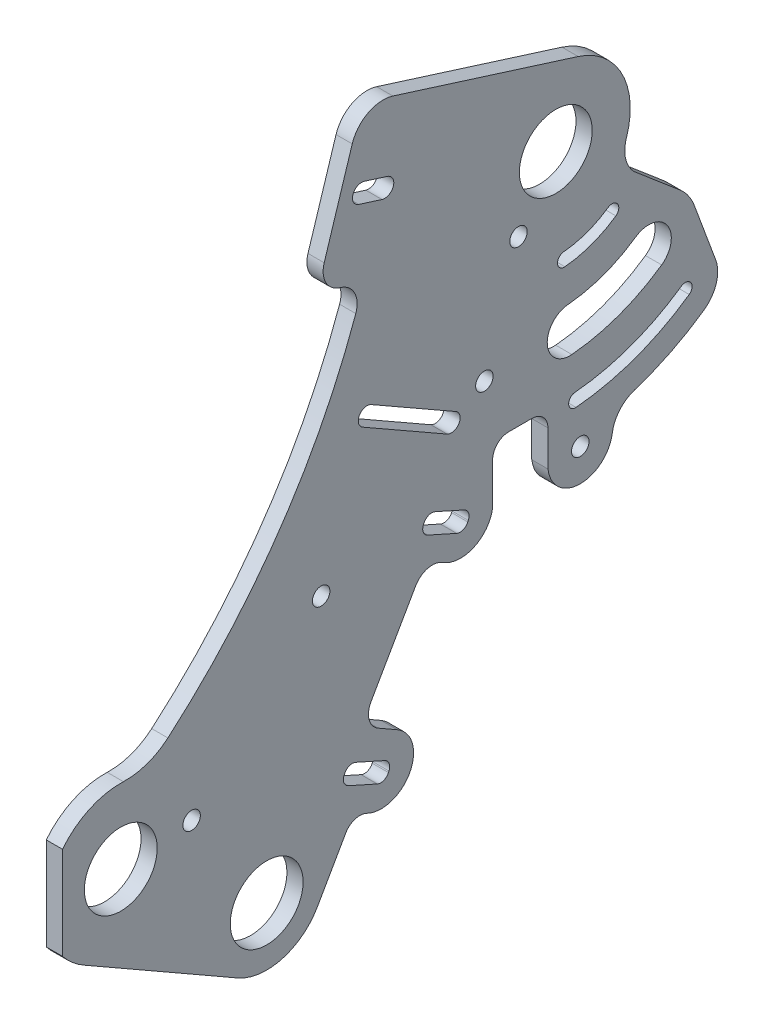
from build123d import *

# Parameters (mm, degrees)
BOSS_EXTRUDE1_DEPTH      = 3.175
BOSS_EXTRUDE1_DEPTH_BACK = 3.175
CUT_EXTRUDE1_DEPTH       = 307.149657193
CUT_EXTRUDE1_DEPTH_BACK  = 307.149657193
SKETCH1_R                = 14.2875
SKETCH1_R_2              = 3.429


with BuildPart() as part:
    # Sketch2 → Boss-Extrude1 (new, two sides: drawn at the far end of the back side and taken through both)
    with BuildSketch(Plane(origin=(0, 0, 0), x_dir=(0, 0, -1), z_dir=(1, 0, 0)).offset(-BOSS_EXTRUDE1_DEPTH_BACK)):
        with BuildLine():
            Line((-71.727341246, 14.712855526), (-11.355316398, -19.840271911))
            ThreePointArc((-11.355316398, -19.840271911), (6.010109789, -22.055796978), (19.850909717, -11.336709549))
            Line((19.850909717, -11.336709549), (31.011761812, 8.206268627))
            ThreePointArc((31.011761812, 8.206268627), (34.662129764, 11.127507824), (39.322849283, 10.758024134))
            ThreePointArc((39.322849283, 10.758024134), (56.134461156, 16.205485457), (51.225250159, 33.182080404))
            Line((51.225250159, 33.182080404), (43.740701856, 37.465762324))
            ThreePointArc((43.740701856, 37.465762324), (40.172936643, 42.0792631), (40.912383352, 47.86429176))
            Line((40.912383352, 47.86429176), (58.4047538, 78.427366702))
            ThreePointArc((58.4047538, 78.427366702), (63.214959672, 82.045828247), (69.150347517, 81.044571224))
            ThreePointArc((69.150347517, 81.044571224), (81.258269009, 80.137892516), (88.594067794, 89.813112686))
            Line((88.594067794, 89.813112686), (88.594067794, 92.199724514))
            Line((88.594067794, 92.199724514), (88.594067794, 106.169724514))
            ThreePointArc((88.594067794, 106.169724514), (90.453939734, 110.659852575), (94.944067794, 112.519724514))
            Line((94.944067794, 112.519724514), (103.937974786, 112.519724514))
            ThreePointArc((103.937974786, 112.519724514), (108.428102847, 110.659852575), (110.287974786, 106.169724514))
            Line((110.287974786, 106.169724514), (110.287974786, 92.199724514))
            Line((110.287974786, 92.199724514), (110.332946369, 92.199724514))
            ThreePointArc((110.332946369, 92.199724514), (122.733798507, 80.828311157), (135.537778495, 91.743817189))
            ThreePointArc((135.537778495, 91.743817189), (138.406050553, 98.151824286), (144.240443192, 102.05687257))
            ThreePointArc((144.240443192, 102.05687257), (158.356459409, 107.777887749), (171.454830285, 115.551214511))
            ThreePointArc((171.454830285, 115.551214511), (176.293542275, 122.170313769), (176.079337299, 130.366637638))
            Line((176.079337299, 130.366637638), (167.652590835, 153.111230605))
            ThreePointArc((167.652590835, 153.111230605), (165.394045644, 157.419573471), (162.117995595, 161.015451766))
            Line((162.117995595, 161.015451766), (144.011829817, 176.386571529))
            ThreePointArc((144.011829817, 176.386571529), (140.738510253, 182.410880382), (141.073716499, 189.25884029))
            ThreePointArc((141.073716499, 189.25884029), (139.389035794, 211.778713703), (122.150711895, 226.367169303))
            Line((122.150711895, 226.367169303), (49.477480248, 249.280951225))
            ThreePointArc((49.477480248, 249.280951225), (39.794309207, 248.433783532), (33.54631132, 240.987709604))
            Line((33.54631132, 240.987709604), (22.547695998, 206.104558413))
            ThreePointArc((22.547695998, 206.104558413), (23.157656737, 199.132675263), (28.518829965, 194.634116785))
            Line((28.518829965, 194.634116785), (29.082706129, 194.456327313))
            ThreePointArc((29.082706129, 194.456327313), (34.521299637, 189.805593755), (34.945098816, 182.662204067))
            ThreePointArc((34.945098816, 182.662204067), (5.090213079, 124.221234623), (-38.738117997, 75.377212399))
            ThreePointArc((-38.738117997, 75.377212399), (-46.886526626, 70.672129884), (-56.188647306, 69.256179485))
            ThreePointArc((-56.188647306, 69.256179485), (-69.442421386, 66.593204099), (-80.077770294, 58.247946829))
            Line((-80.077770294, 58.247946829), (-80.077770294, 21.880681329))
            ThreePointArc((-80.077770294, 21.880681329), (-76.243164901, 17.899962972), (-71.727341246, 14.712855526))
        make_face()
    extrude(amount=BOSS_EXTRUDE1_DEPTH + BOSS_EXTRUDE1_DEPTH_BACK)

    # Sketch1 → Cut-Extrude1 (cut, two sides: drawn at the far end of the back side and taken through both)
    with BuildSketch(Plane(origin=(0, 0, 0), x_dir=(0, 0, -1), z_dir=(1, 0, 0)).offset(-CUT_EXTRUDE1_DEPTH_BACK)):
        Circle(SKETCH1_R)
        with Locations((-57.217770294, 40.064314079)):
            Circle(SKETCH1_R)
        with Locations((113.367095492, 198.509097171)):
            Circle(SKETCH1_R)
        with Locations((-29.436520294, 42.726234079)):
            Circle(SKETCH1_R_2)
        with Locations((21.363479706, 93.526234079)):
            Circle(SKETCH1_R_2)
        with Locations((122.963479706, 93.526234079)):
            Circle(SKETCH1_R_2)
        with Locations((98.744155059, 176.904777846)):
            Circle(SKETCH1_R_2)
        with Locations((85.377782271, 134.512059385)):
            Circle(SKETCH1_R_2)
        with BuildLine():
            Line((30.555516965, 28.585224085), (30.360175827, 28.148630754))
            ThreePointArc((30.360175827, 28.148630754), (30.289083082, 25.61101973), (32.033174884, 23.766387604))
            Line((32.033174884, 23.766387604), (43.366777865, 18.695492686))
            ThreePointArc((43.366777865, 18.695492686), (45.904388889, 18.624399941), (47.749021015, 20.368491743))
            Line((47.749021015, 20.368491743), (47.944362153, 20.805085073))
            ThreePointArc((47.944362153, 20.805085073), (48.015454897, 23.342696098), (46.271363096, 25.187328223))
            Line((46.271363096, 25.187328223), (34.937760115, 30.258223141))
            ThreePointArc((34.937760115, 30.258223141), (32.40014909, 30.329315886), (30.555516965, 28.585224085))
        make_face()
        with BuildLine():
            Line((36.134107155, 219.131995286), (45.218261111, 216.267772546))
            ThreePointArc((45.218261111, 216.267772546), (49.67898841, 218.5898802), (47.356880757, 223.0506075))
            Line((47.356880757, 223.0506075), (38.272726801, 225.91483024))
            ThreePointArc((38.272726801, 225.91483024), (33.811999501, 223.592722586), (36.134107155, 219.131995286))
        make_face()
        with BuildLine():
            Line((61.67607301, 98.140604836), (61.480731873, 97.704011505))
            ThreePointArc((61.480731873, 97.704011505), (61.409639128, 95.166400481), (63.153730929, 93.321768355))
            Line((63.153730929, 93.321768355), (74.487333911, 88.250873437))
            ThreePointArc((74.487333911, 88.250873437), (77.024944935, 88.179780692), (78.86957706, 89.923872494))
            Line((78.86957706, 89.923872494), (79.064918198, 90.360465824))
            ThreePointArc((79.064918198, 90.360465824), (79.136010943, 92.898076849), (77.391919142, 94.742708974))
            Line((77.391919142, 94.742708974), (66.05831616, 99.813603892))
            ThreePointArc((66.05831616, 99.813603892), (63.520705136, 99.884696637), (61.67607301, 98.140604836))
        make_face()
        with BuildLine():
            Line((70.728471243, 123.847620068), (37.643621714, 142.742135984))
            ThreePointArc((37.643621714, 142.742135984), (36.366491689, 147.420278874), (41.044634579, 148.697408899))
            Line((41.044634579, 148.697408899), (74.129484108, 129.802892984))
            ThreePointArc((74.129484108, 129.802892984), (75.406614133, 125.124750094), (70.728471243, 123.847620068))
        make_face()
        with BuildLine():
            ThreePointArc((118.126670603, 144.106904708), (110.04531429, 134.475919289), (119.676299709, 126.394562976))
            ThreePointArc((119.676299709, 126.394562976), (138.125933667, 130.484748353), (154.888293719, 139.210680685))
            ThreePointArc((154.888293719, 139.210680685), (157.071460874, 151.592036878), (144.690104681, 153.775204033))
            ThreePointArc((144.690104681, 153.775204033), (132.044815519, 147.19248315), (118.126670603, 144.106904708))
        make_face()
        with BuildLine():
            ThreePointArc((116.483795739, 162.885050332), (114.059388845, 159.995754706), (116.948684471, 157.571347812))
            ThreePointArc((116.948684471, 157.571347812), (127.422113984, 159.893251235), (136.937717213, 164.846760742))
            ThreePointArc((136.937717213, 164.846760742), (137.59266736, 168.5611676), (133.878260502, 169.216117746))
            ThreePointArc((133.878260502, 169.216117746), (125.597778539, 164.905571674), (116.483795739, 162.885050332))
        make_face()
        with BuildLine():
            ThreePointArc((120.854285842, 112.930119872), (118.429878948, 110.040824247), (121.319174574, 107.616417353))
            ThreePointArc((121.319174574, 107.616417353), (144.572970647, 112.771659829), (165.700137899, 123.769766971))
            ThreePointArc((165.700137899, 123.769766971), (166.355088045, 127.484173829), (162.640681187, 128.139123976))
            ThreePointArc((162.640681187, 128.139123976), (142.748635202, 117.783980268), (120.854285842, 112.930119872))
        make_face()
    extrude(amount=CUT_EXTRUDE1_DEPTH + CUT_EXTRUDE1_DEPTH_BACK, mode=Mode.SUBTRACT)


solid = part.part
